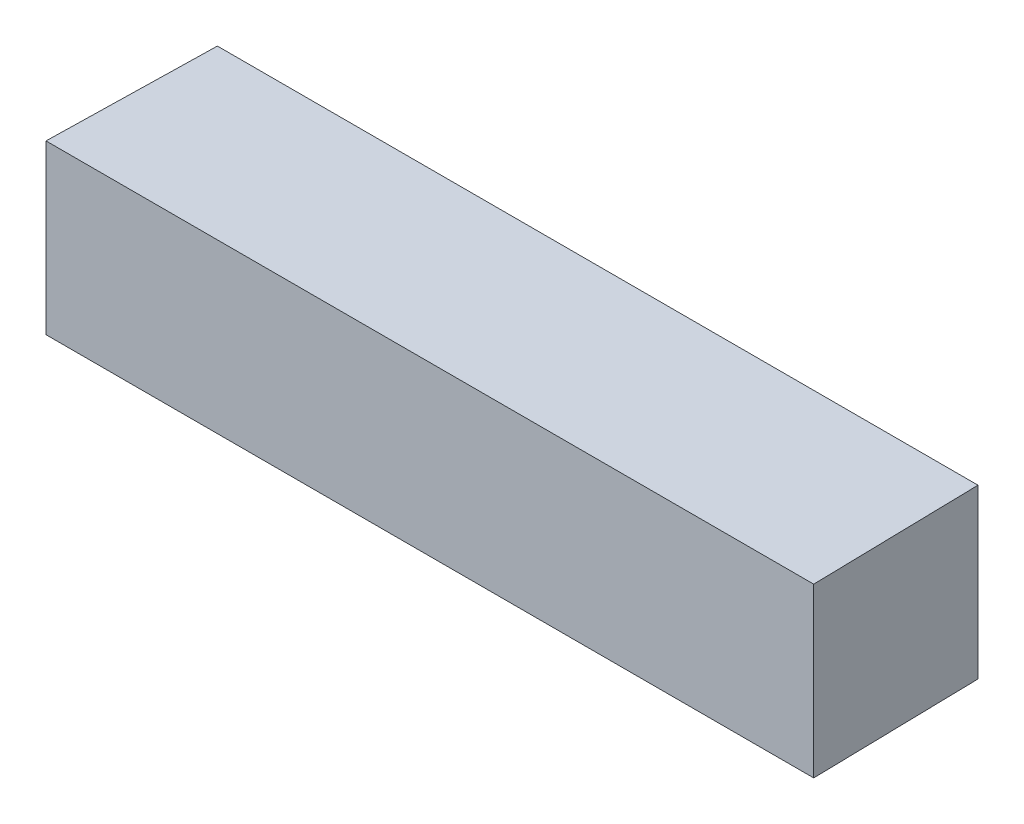
from build123d import *

# Parameters (mm, degrees)
BOSS_EXTRUDE1_DEPTH = 20


with BuildPart() as part:
    # Sketch1 → Boss-Extrude1 (new body)
    with BuildSketch(Plane(origin=(0, 0, 0), x_dir=(1, 0, 0), z_dir=(0, 1, 0))):
        Polygon((-45.74, 0), (-45.315821408, 20), (45.315821408, 20), (45.74, 0), align=None)
    extrude(amount=BOSS_EXTRUDE1_DEPTH)


solid = part.part
